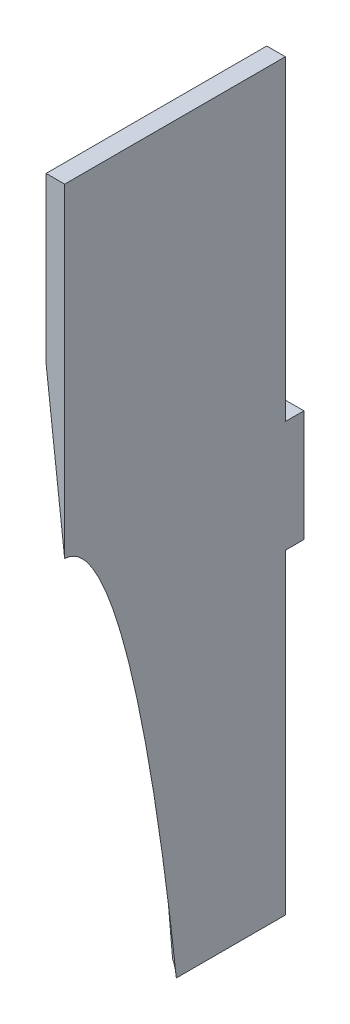
from build123d import *

# Parameters (mm, degrees)
SKETCH2_W           = 25.4
SKETCH2_H           = 63.5
BOSS_EXTRUDE1_DEPTH = 1.5875
SKETCH3_W           = 1.5875
SKETCH3_H           = 9.525
BOSS_EXTRUDE2_DEPTH = 1.5875
SKETCH3_4_W         = 1.5875
SKETCH3_4_H         = 9.525
CUT_EXTRUDE1_DEPTH  = 3.175
CUT_EXTRUDE2_DEPTH  = 35.85276621
CAVITY1_OUTLINE_W   = 13.081
CAVITY1_OUTLINE_H   = 49.289563405


# Read off the part's stored shape, not the designer's step: Cavity1
with BuildPart() as part:
    # Sketch2 → Boss-Extrude1 (new body)
    with BuildSketch(Plane(origin=(0, 0, 0), x_dir=(0, 0, -1), z_dir=(1, 0, 0))):
        Rectangle(SKETCH2_W, SKETCH2_H)
    extrude(amount=BOSS_EXTRUDE1_DEPTH)

    # Sketch3 → Boss-Extrude2 (add)
    with BuildSketch(Plane(origin=(1.5875, 0, 0), x_dir=(0, 0, -1), z_dir=(1, 0, 0))):
        with Locations((13.49375, 0)):
            Rectangle(SKETCH3_W, SKETCH3_H)
    extrude(amount=-BOSS_EXTRUDE2_DEPTH)

    # Sketch3<4> → Cut-Extrude1 (cut)
    with BuildSketch(Plane(origin=(1.5875, 0, 0), x_dir=(0, 0, -1), z_dir=(1, 0, 0))):
        with Locations((-11.90625, 0)):
            Rectangle(SKETCH3_4_W, SKETCH3_4_H)
    extrude(amount=-CUT_EXTRUDE1_DEPTH, mode=Mode.SUBTRACT)

    # Sketch4 → Cut-Extrude2 (cut, through all)
    with BuildSketch(Plane(origin=(1.5875, 0, 0), x_dir=(0, 0, -1), z_dir=(1, 0, 0))):
        Polygon((-6.14934, 31.75), (-6.14934, -31.75), (-12.7, -31.75), (-12.7, -4.7625), (-11.1125, -4.7625), (-11.1125, 4.7625), (-12.7, 4.7625), (-12.7, 31.75), align=None)
    extrude(amount=-CUT_EXTRUDE2_DEPTH, mode=Mode.SUBTRACT)

    # Cavity1 outline → Cavity1 (revolve, cut)
    with BuildSketch(Plane(origin=(-10.964254269, -1.274913287, 6.150528853), x_dir=(0.9933073803012532, 0.11550085817456804, 0), z_dir=(0, 0, -1))):
        with Locations((6.5405, 7.076085234)):
            Rectangle(CAVITY1_OUTLINE_W, CAVITY1_OUTLINE_H)
    revolve(axis=Axis((-10.964254269, -1.274913287, 6.150528853), (0.11550085817456807, -0.9933073803012534, 0)), mode=Mode.SUBTRACT)


solid = part.part
